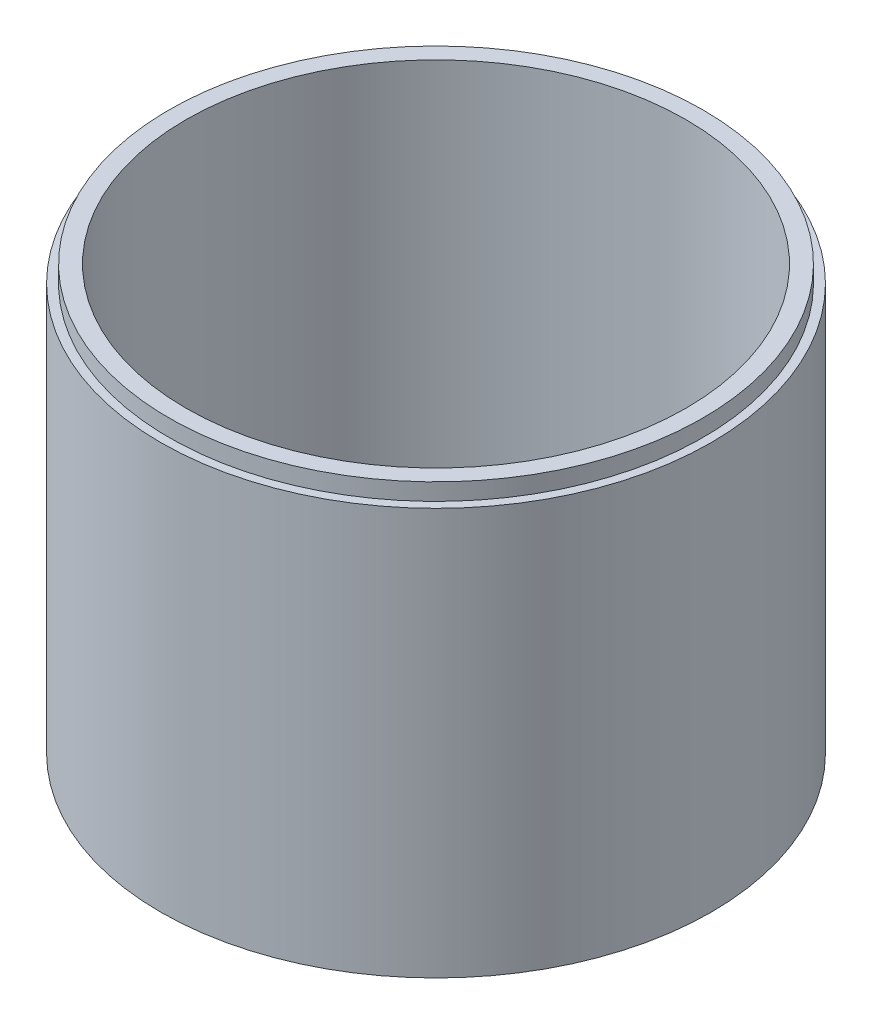
from build123d import *


with BuildPart() as part:
    # Szkic1 → Obrót1 (revolve)
    with BuildSketch(Plane.XY):
        Polygon((-65, 0), (-63, 0), (-63, 4), (-59, 4), (-59, 100), (-63, 100), (-63, 96), (-65, 96), (-65, 4), align=None)
    revolve(axis=Axis((0, 0, 0), (0, 1, 0)))


solid = part.part
